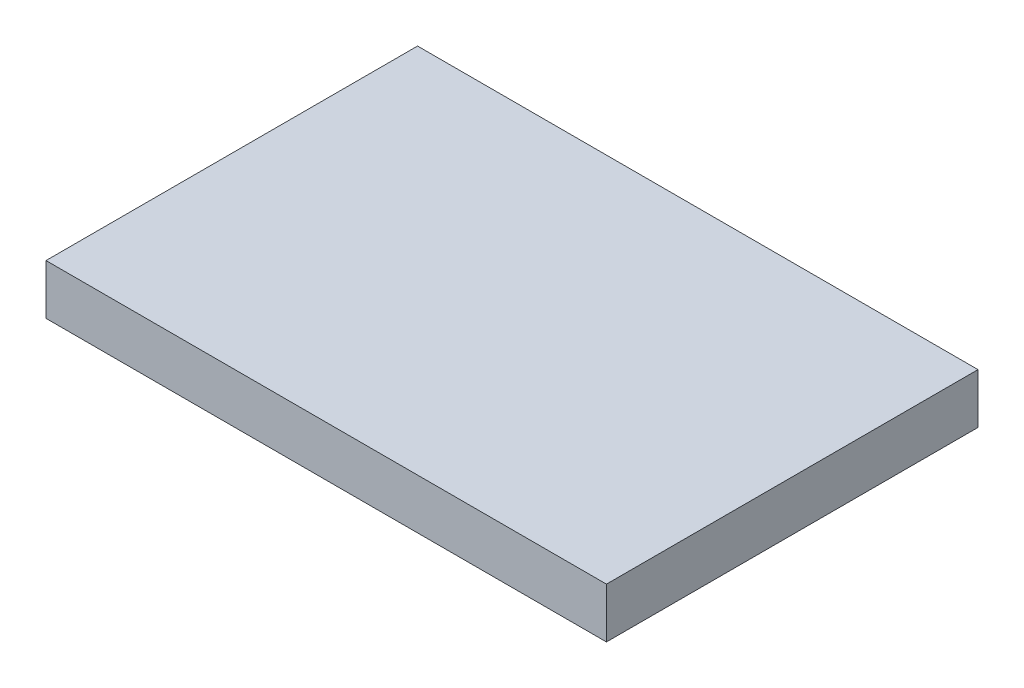
from build123d import *

# Parameters (mm, degrees)
SKETCH3_W           = 3409.95
SKETCH3_H           = 2260.6
BOSS_EXTRUDE3_DEPTH = 304.8


with BuildPart() as part:
    # Sketch3 → Boss-Extrude3 (new body)
    with BuildSketch(Plane(origin=(0, 0, 0), x_dir=(-1, 0, 0), z_dir=(0, 1, 0))):
        Rectangle(SKETCH3_W, SKETCH3_H)
    extrude(amount=BOSS_EXTRUDE3_DEPTH)


solid = part.part
